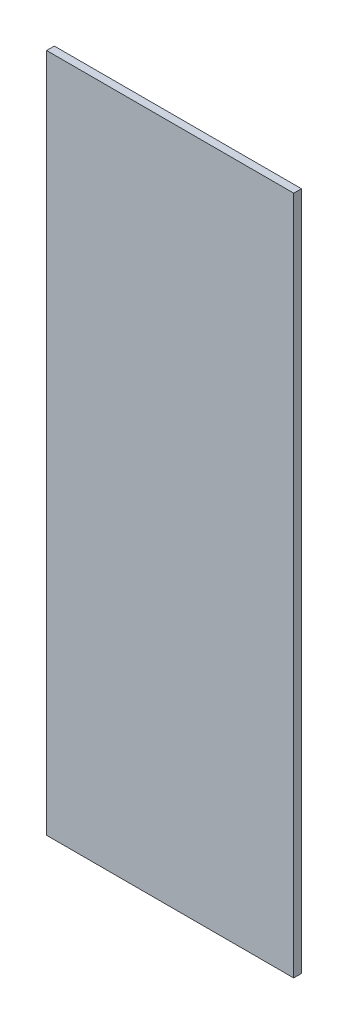
from build123d import *

# Parameters (mm, degrees)
SKETCH2_W           = 50.8
SKETCH2_H           = 139.7
BOSS_EXTRUDE1_DEPTH = 1.5875


with BuildPart() as part:
    # Sketch2 → Boss-Extrude1 (new body)
    with BuildSketch(Plane.XY):
        with Locations((25.4, 69.85)):
            Rectangle(SKETCH2_W, SKETCH2_H)
    extrude(amount=BOSS_EXTRUDE1_DEPTH)


solid = part.part
